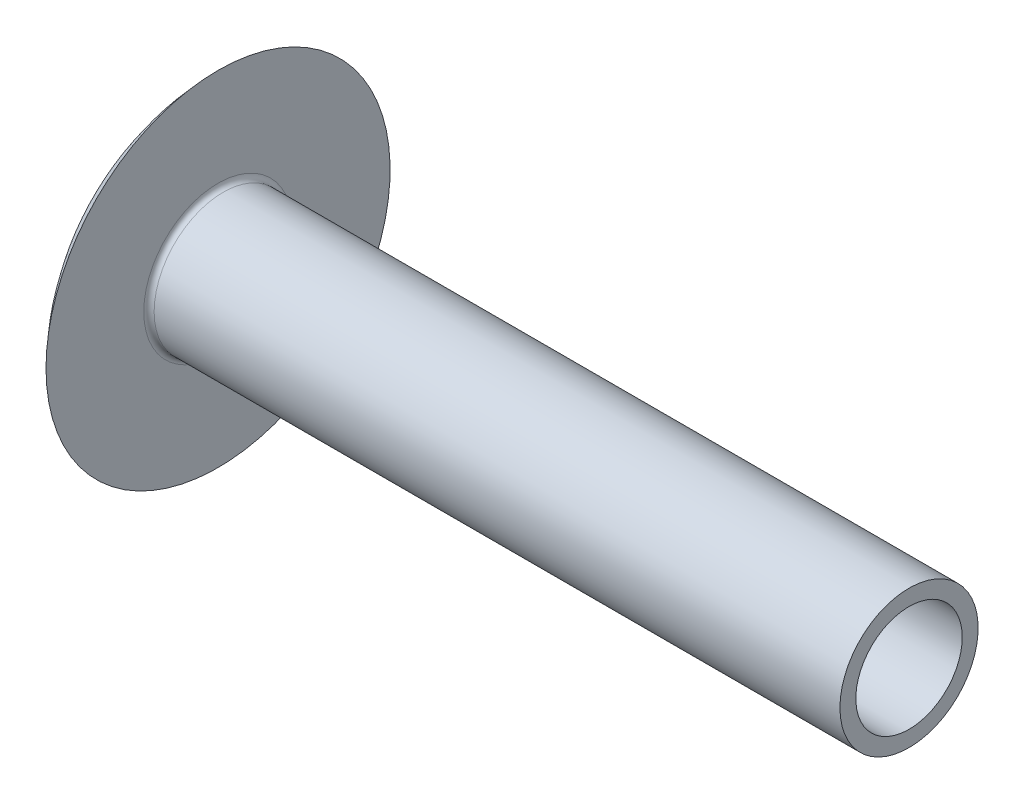
from build123d import *


with BuildPart() as part:
    # Sketch1 → Base-Revolve (revolve)
    with BuildSketch(Plane.XY):
        with BuildLine():
            Line((43.962049535, 0), (43.962049535, 4))
            Line((43.962049535, 4), (4.262049535, 4))
            ThreePointArc((4.262049535, 4), (4.049917501, 4.087867966), (3.962049535, 4.3))
            Line((3.962049535, 4.3), (3.962049535, 9.96))
            ThreePointArc((3.962049535, 9.96), (1.026873382, 5.359557736), (0, 0))
            Line((0, 0), (43.962049535, 0))
        make_face()
    revolve(axis=Axis((-60.094413408, 0, 0), (1, 0, 0)))

    # Sketch2 → Cut-Revolve1 (revolve, cut)
    with BuildSketch(Plane.XY):
        Polygon((43.962049535, 0), (43.962049535, 3.08), (36.312049535, 3.08), (34.074298549, 0), align=None)
    revolve(axis=Axis((2.23767105, 0, 0), (-1, 0, 0)), mode=Mode.SUBTRACT)


solid = part.part
